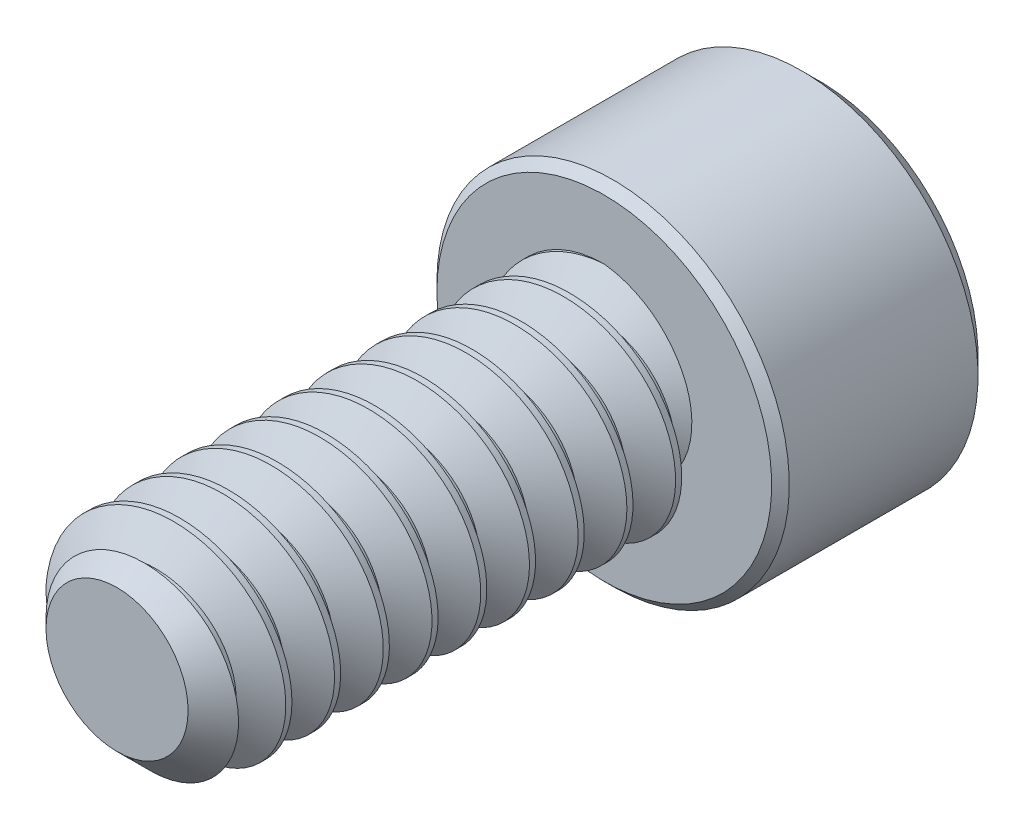
from build123d import *

# Parameters (mm, degrees)
SKETCH1_R          = 1.7526
EXTRUDE1_DEPTH     = 7.9375
CHAMFER3_SIZE      = 0.5953125
CUT_SWEEP1_PITCH   = 0.79375
SKETCH6_R          = 2.8702
EXTRUDE2_DEPTH     = 3.5052
CUT_EXTRUDE1_DEPTH = 2.08359375
CHAMFER1_SIZE      = 0.28702
CHAMFER2_SIZE      = 0.14351


with BuildPart() as part:
    # Sketch1 → Extrude1 (new body)
    with BuildSketch(Plane.XY):
        Circle(SKETCH1_R)
    extrude(amount=-EXTRUDE1_DEPTH)

    # Chamfer3
    chamfer3_edges = [part.edges().sort_by_distance(p)[0] for p in [
        (-1.7526, 0, 0),
    ]]
    chamfer(chamfer3_edges, length=CHAMFER3_SIZE)

    # Cut-Sweep1: the profile of Sketch3 profile screwed along a right-hand helix of 11 turns, 6 arcs to a turn; built about Z, then put on its axis
    cut_sweep1_z = Axis((0, 0, 0), (0, 0, 1))
    cut_sweep1_corners = [(1.7529, 0, -0.694704455), (1.237044252, 0, -0.396875), (1.237044252, 0, -0.29765625), (1.7529, 0, 0.000173205)]
    with BuildLine(mode=Mode.PRIVATE) as cut_sweep1_profile:
        Line(cut_sweep1_corners[0], cut_sweep1_corners[1])
        Line(cut_sweep1_corners[1], cut_sweep1_corners[2])
        Line(cut_sweep1_corners[2], cut_sweep1_corners[3])
        Line(cut_sweep1_corners[3], cut_sweep1_corners[0])
    cut_sweep1_cap = Face(cut_sweep1_profile.wire())
    cut_sweep1_turn_angles = [0, 30, 60, 90, 120, 150, 180, 210, 240, 270, 300, 330, 360]
    cut_sweep1_turn_weights = [1, 0.8660254037844387, 1, 0.8660254037844387, 1, 0.8660254037844387, 1, 0.8660254037844387, 1, 0.8660254037844387, 1, 0.8660254037844387, 1]
    cut_sweep1_turn_rails = [Edge.make_bspline([Vector(p[0], p[1], 0).rotate(cut_sweep1_z, cut_sweep1_turn_angles[k]) / cut_sweep1_turn_weights[k] + Vector(0, 0, p[2] + CUT_SWEEP1_PITCH * cut_sweep1_turn_angles[k] / 360) for k in range(13)], [0, 0, 0, 1, 1, 2, 2, 3, 3, 4, 4, 5, 5, 6, 6, 6], 2, cut_sweep1_turn_weights) for p in cut_sweep1_corners]
    cut_sweep1_turn_sides = [Face.make_surface_from_curves(cut_sweep1_turn_rails[p[0]], cut_sweep1_turn_rails[p[1]]) for p in [(0, 1), (1, 2), (2, 3), (3, 0)]]
    cut_sweep1 = Plane(origin=(0, 0, 0), x_dir=(0, 1, 0), z_dir=(0, 0, -1)) * Solid(Shell([*[p.moved(Location((0, 0, CUT_SWEEP1_PITCH * i))) for i in range(11) for p in cut_sweep1_turn_sides], cut_sweep1_cap, cut_sweep1_cap.rotate(cut_sweep1_z, 3960).moved(Location((0, 0, CUT_SWEEP1_PITCH * 3960 / 360)))]))
    add(cut_sweep1, mode=Mode.SUBTRACT)

    # Sketch6 → Extrude2 (add)
    with BuildSketch(Plane(origin=(0, 0, -7.9375), x_dir=(-1, 0, 0), z_dir=(0, 0, -1))):
        Circle(SKETCH6_R)
    extrude(amount=EXTRUDE2_DEPTH)

    # Sketch7 → Cut-Extrude1 (cut)
    with BuildSketch(Plane(origin=(0, 0, -11.4427), x_dir=(-1, 0, 0), z_dir=(0, 0, -1))):
        Polygon((0, 1.603951217), (-1.3890625, 0.801975608), (-1.3890625, -0.801975608), (0, -1.603951217), (1.3890625, -0.801975608), (1.3890625, 0.801975608), align=None)
    extrude(amount=-CUT_EXTRUDE1_DEPTH, mode=Mode.SUBTRACT)

    # Cut-Extrude2 cone 1 section (through the dimple's axis) → Cut-Extrude2 (revolve, cut)
    with BuildSketch(Plane(origin=(0, 0, -11.4427), x_dir=(0, 1, 0), z_dir=(1, 0, 0))):
        Polygon((0, 0), (1.603951217, 0), (0, 1.603951217), align=None)
    revolve(axis=Axis((0, 0, -11.4427), (0, 0, 1)), mode=Mode.SUBTRACT)

    # Chamfer1
    chamfer1_edges = [part.edges().sort_by_distance(p)[0] for p in [
        (2.8702, 0, -11.4427),
    ]]
    chamfer(chamfer1_edges, length=CHAMFER1_SIZE)

    # Chamfer2
    chamfer2_edges = [part.edges().sort_by_distance(p)[0] for p in [
        (2.8702, 0, -7.9375),
    ]]
    chamfer(chamfer2_edges, length=CHAMFER2_SIZE)


solid = part.part
